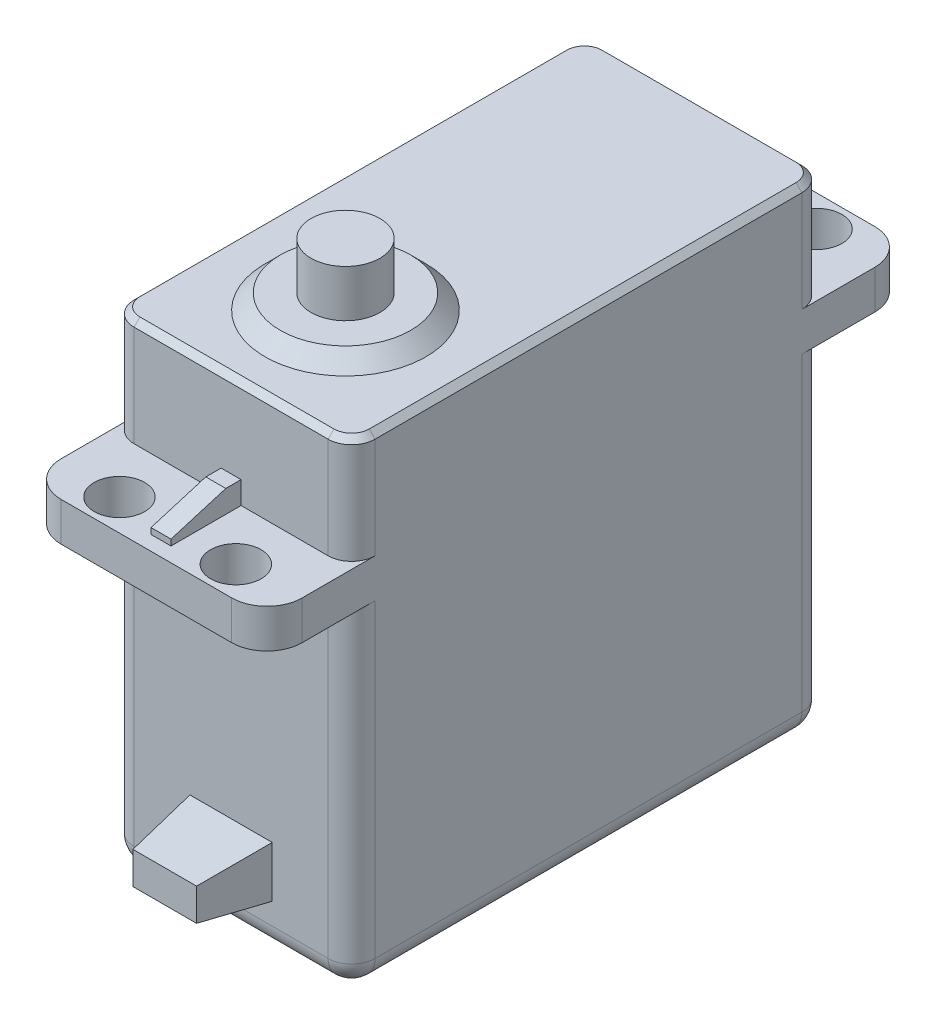
from build123d import *

# Parameters (mm, degrees)
SKETCH1_W           = 40.3
SKETCH1_H           = 40.75
BOSS_EXTRUDE1_DEPTH = 10.25
SKETCH2_R           = 2.93
BOSS_EXTRUDE2_DEPTH = 5.3
SKETCH3_R           = 6.85
BOSS_EXTRUDE3_DEPTH = 1.3
CHAMFER1_SIZE       = 1.3
BOSS_EXTRUDE4_START = 28.36
SKETCH4_W           = 20.5
SKETCH4_H           = 7.2
BOSS_EXTRUDE4_DEPTH = 3.3
CUT_EXTRUDE1_REACH  = 59.997
SKETCH5_R           = 2.15
FILLET1_R           = 2
FILLET2_R           = 3
BOSS_EXTRUDE5_DEPTH = 0.85
CHAMFER2_SIZE       = 0.5
SKETCH8_W           = 7
SKETCH8_H           = 4.33
BOSS_EXTRUDE6_DEPTH = 5.64
BOSS_EXTRUDE6_TAPER = 8


with BuildPart() as part:
    # Sketch1 → Boss-Extrude1 (new, symmetric)
    with BuildSketch(Plane(origin=(0, 0, 0), x_dir=(0, 0, -1), z_dir=(1, 0, 0))):
        with Locations((20.15, 20.375)):
            Rectangle(SKETCH1_W, SKETCH1_H)
    extrude(amount=BOSS_EXTRUDE1_DEPTH, both=True)

    # Sketch2 → Boss-Extrude2 (add)
    with BuildSketch(Plane(origin=(0, 40.75, 0), x_dir=(1, 0, 0), z_dir=(0, 1, 0))):
        with Locations(Location((0, 9.73, 0), (0, 0, 90))):
            Circle(SKETCH2_R)
    extrude(amount=BOSS_EXTRUDE2_DEPTH)

    # Sketch3 → Boss-Extrude3 (add)
    with BuildSketch(Plane(origin=(0, 40.75, 0), x_dir=(1, 0, 0), z_dir=(0, 1, 0))):
        with Locations(Location((0, 9.73, 0), (0, 0, 90))):
            Circle(SKETCH3_R)
    extrude(amount=BOSS_EXTRUDE3_DEPTH)

    # Chamfer1
    chamfer1_edges = [part.edges().sort_by_distance(p)[0] for p in [
        (0, 42.05, -2.88),
    ]]
    chamfer(chamfer1_edges, length=CHAMFER1_SIZE - 0.0001)  # a hair under: the kernel refuses the full size

    # Sketch4 → Boss-Extrude4 (add)
    with BuildSketch(Plane(origin=(0, 0, 0), x_dir=(1, 0, 0), z_dir=(0, 1, 0)).offset(BOSS_EXTRUDE4_START)):
        with Locations((0, -3.6)):
            Rectangle(SKETCH4_W, SKETCH4_H)
        with Locations((0, 43.9)):
            Rectangle(SKETCH4_W, SKETCH4_H)
    extrude(amount=BOSS_EXTRUDE4_DEPTH)

    # Sketch5 → Cut-Extrude1 (cut, up to next)
    with BuildSketch(Plane(origin=(0, 31.66, 0), x_dir=(1, 0, 0), z_dir=(0, 1, 0)), mode=Mode.PRIVATE) as cut_extrude1_sk1:
        with Locations(Location((4.95, -4.545, 0), (0, 0, 270))):
            Circle(SKETCH5_R)
    cut_extrude1_tool1 = extrude(cut_extrude1_sk1.sketch, amount=-CUT_EXTRUDE1_REACH, mode=Mode.PRIVATE) & part.part
    # Sketch5 → Cut-Extrude1 (cut, up to next)
    with BuildSketch(Plane(origin=(0, 31.66, 0), x_dir=(1, 0, 0), z_dir=(0, 1, 0)), mode=Mode.PRIVATE) as cut_extrude1_sk2:
        with Locations(Location((-4.95, -4.545, 0), (0, 0, 270))):
            Circle(SKETCH5_R)
    cut_extrude1_tool2 = extrude(cut_extrude1_sk2.sketch, amount=-CUT_EXTRUDE1_REACH, mode=Mode.PRIVATE) & part.part
    # Sketch5 → Cut-Extrude1 (cut, up to next)
    with BuildSketch(Plane(origin=(0, 31.66, 0), x_dir=(1, 0, 0), z_dir=(0, 1, 0)), mode=Mode.PRIVATE) as cut_extrude1_sk3:
        with Locations(Location((4.95, 44.845, 0), (0, 0, 270))):
            Circle(SKETCH5_R)
    cut_extrude1_tool3 = extrude(cut_extrude1_sk3.sketch, amount=-CUT_EXTRUDE1_REACH, mode=Mode.PRIVATE) & part.part
    # Sketch5 → Cut-Extrude1 (cut, up to next)
    with BuildSketch(Plane(origin=(0, 31.66, 0), x_dir=(1, 0, 0), z_dir=(0, 1, 0)), mode=Mode.PRIVATE) as cut_extrude1_sk4:
        with Locations(Location((-4.95, 44.845, 0), (0, 0, 270))):
            Circle(SKETCH5_R)
    cut_extrude1_tool4 = extrude(cut_extrude1_sk4.sketch, amount=-CUT_EXTRUDE1_REACH, mode=Mode.PRIVATE) & part.part
    add(cut_extrude1_tool1.solids().sort_by_distance((4.95, 31.66, 4.545))[0], mode=Mode.SUBTRACT)
    add(cut_extrude1_tool2.solids().sort_by_distance((-4.95, 31.66, 4.545))[0], mode=Mode.SUBTRACT)
    add(cut_extrude1_tool3.solids().sort_by_distance((4.95, 31.66, -44.845))[0], mode=Mode.SUBTRACT)
    add(cut_extrude1_tool4.solids().sort_by_distance((-4.95, 31.66, -44.845))[0], mode=Mode.SUBTRACT)

    # Fillet1
    fillet1_edges = [part.edges().sort_by_distance(p)[0] for p in [
        (10.25, 14.18, -40.3),
        (-10.25, 14.18, 0),
        (10.25, 14.18, 0),
        (-10.25, 36.205, -40.3),
        (10.25, 36.205, -40.3),
        (10.25, 36.205, 0),
        (-10.25, 14.18, -40.3),
        (-10.25, 0, -20.15),
        (-10.25, 36.205, 0),
        (0, 0, -40.3),
        (0, 0, 0),
        (10.25, 0, -20.15),
    ]]
    fillet(fillet1_edges, radius=FILLET1_R)

    # Fillet2
    fillet2_edges = [part.edges().sort_by_distance(p)[0] for p in [
        (-10.25, 30.01, 7.2),
        (10.25, 30.01, 7.2),
        (10.25, 30.01, -47.5),
        (-10.25, 30.01, -47.5),
    ]]
    fillet(fillet2_edges, radius=FILLET2_R)

    # Sketch7 → Boss-Extrude5 (add, symmetric)
    with BuildSketch(Plane(origin=(0, 0, 0), x_dir=(0, 0, -1), z_dir=(1, 0, 0))):
        Polygon((0, 31.66), (0, 33.57), (-1.3, 33.57), (-5.96, 32.169632375), (-5.96, 31.66), align=None)
    boss_extrude5 = extrude(amount=BOSS_EXTRUDE5_DEPTH, both=True)

    # Mirror1: Boss-Extrude5 across plane
    add(boss_extrude5.mirror(Plane.XY.offset(-20.15)))

    # Chamfer2
    chamfer2_edges = [part.edges().sort_by_distance(p)[0] for p in [
        (10.25, 40.75, -20.15),
        (-10.25, 40.75, -20.15),
        (0, 40.75, 0),
        (0, 40.75, -40.3),
        (9.664213562, 40.75, -39.714213562),
        (-9.664213562, 40.75, -39.714213562),
        (9.664213562, 40.75, -0.585786438),
        (-9.664213562, 40.75, -0.585786438),
    ]]
    chamfer(chamfer2_edges, length=CHAMFER2_SIZE)

    # Sketch8 → Boss-Extrude6 (add)
    with BuildSketch(Plane.XY):
        with Locations((0, 6.005)):
            Rectangle(SKETCH8_W, SKETCH8_H)
    extrude(amount=BOSS_EXTRUDE6_DEPTH, taper=BOSS_EXTRUDE6_TAPER)


solid = part.part
